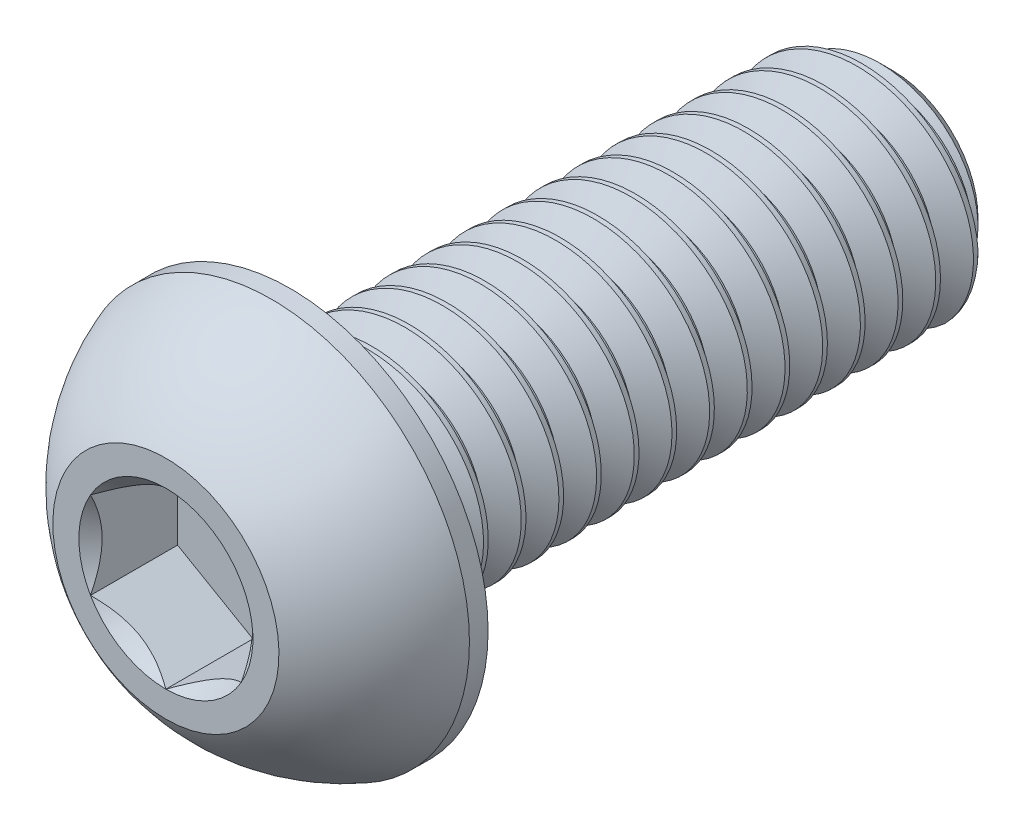
from build123d import *

# Parameters (mm, degrees)
SKETCH1_W          = 16
SKETCH1_H          = 3
CHAMFER1_SIZE      = 0.75
CUT_SWEEP1_PITCH   = 1
CUT_EXTRUDE2_DEPTH = 2.31


with BuildPart() as part:
    # Sketch1 → Revolve1 (revolve)
    with BuildSketch(Plane(origin=(0, 0, 0), x_dir=(0, 0, -1), z_dir=(1, 0, 0))):
        with Locations((11.3, 1.5)):
            Rectangle(SKETCH1_W, SKETCH1_H)
    revolve(axis=Axis((0, 0, -19.3), (0, 0, 1)))

    # Chamfer1
    chamfer1_edges = [part.edges().sort_by_distance(p)[0] for p in [
        (0, -3, -19.3),
    ]]
    chamfer(chamfer1_edges, length=CHAMFER1_SIZE)

    # Cut-Sweep1: arcs per turn and ends read off the stored shape
    # Cut-Sweep1: the profile of Sketch2 profile screwed along a right-hand helix through 17 turns, 8 arcs to a turn; built about Z, then put on its axis
    cut_sweep1_z = Axis((0, 0, 0), (0, 0, 1))
    cut_sweep1_corners = [(3.0003, 0, 0.000173205), (3.0003, 0, -0.875173205), (2.350480947, 0, -0.5), (2.350480947, 0, -0.375)]
    with BuildLine(mode=Mode.PRIVATE) as cut_sweep1_profile:
        Line(cut_sweep1_corners[0], cut_sweep1_corners[1])
        Line(cut_sweep1_corners[1], cut_sweep1_corners[2])
        Line(cut_sweep1_corners[2], cut_sweep1_corners[3])
        Line(cut_sweep1_corners[3], cut_sweep1_corners[0])
    cut_sweep1_cap = Face(cut_sweep1_profile.wire())
    cut_sweep1_turn_angles = [0, 22.5, 45, 67.5, 90, 112.5, 135, 157.5, 180, 202.5, 225, 247.5, 270, 292.5, 315, 337.5, 360]
    cut_sweep1_turn_weights = [1, 0.9238795325112867, 1, 0.9238795325112867, 1, 0.9238795325112867, 1, 0.9238795325112867, 1, 0.9238795325112867, 1, 0.9238795325112867, 1, 0.9238795325112867, 1, 0.9238795325112867, 1]
    cut_sweep1_turn_rails = [Edge.make_bspline([Vector(p[0], p[1], 0).rotate(cut_sweep1_z, cut_sweep1_turn_angles[k]) / cut_sweep1_turn_weights[k] + Vector(0, 0, p[2] + CUT_SWEEP1_PITCH * cut_sweep1_turn_angles[k] / 360) for k in range(17)], [0, 0, 0, 1, 1, 2, 2, 3, 3, 4, 4, 5, 5, 6, 6, 7, 7, 8, 8, 8], 2, cut_sweep1_turn_weights) for p in cut_sweep1_corners]
    cut_sweep1_turn_sides = [Face.make_surface_from_curves(cut_sweep1_turn_rails[p[0]], cut_sweep1_turn_rails[p[1]]) for p in [(0, 1), (1, 2), (2, 3), (3, 0)]]
    cut_sweep1 = Plane(origin=(0, 0, -19.3), x_dir=(0, 1, 0), z_dir=(0, 0, 1)) * Solid(Shell([*[p.moved(Location((0, 0, CUT_SWEEP1_PITCH * i))) for i in range(17) for p in cut_sweep1_turn_sides], cut_sweep1_cap, cut_sweep1_cap.rotate(cut_sweep1_z, 6120).moved(Location((0, 0, CUT_SWEEP1_PITCH * 6120 / 360)))]))
    add(cut_sweep1, mode=Mode.SUBTRACT)

    # Sketch7 → Revolve2 (revolve)
    with BuildSketch(Plane(origin=(0, 0, 0), x_dir=(0, 0, -1), z_dir=(1, 0, 0)), mode=Mode.PRIVATE) as revolve2_sk:
        with BuildLine():
            Line((2.805, 5.25), (3.3, 5.25))
            Line((3.3, 5.25), (3.3, 0))
            Line((3.3, 0), (0, 0))
            Line((0, 0), (0, 3))
            ThreePointArc((0, 3), (1.216479019, 4.356906156), (2.805, 5.25))
        make_face()
    revolve(revolve2_sk.sketch.rotate(Axis((0, 0, 0), (0, 0, -1)), 189.052465709), axis=Axis((0, 0, 0), (0, 0, -1)))

    # Sketch5 → Cut-Extrude2 (cut)
    with BuildSketch(Plane.XY):
        Polygon((2, -1.154700538), (2, 1.154700538), (0, 2.309401077), (-2, 1.154700538), (-2, -1.154700538), (0, -2.309401077), align=None)
    extrude(amount=-CUT_EXTRUDE2_DEPTH, mode=Mode.SUBTRACT)

    # Cut-Extrude3 cone 1 section (through the dimple's axis) → Cut-Extrude3 (revolve, cut)
    with BuildSketch(Plane(origin=(0, 0, 0), x_dir=(0, -1, 0), z_dir=(1, 0, 0))):
        Polygon((0, 0), (2.309401077, 0), (0, 2.309401077), align=None)
    revolve(axis=Axis((0, 0, 0), (0, 0, -1)), mode=Mode.SUBTRACT)


solid = part.part
